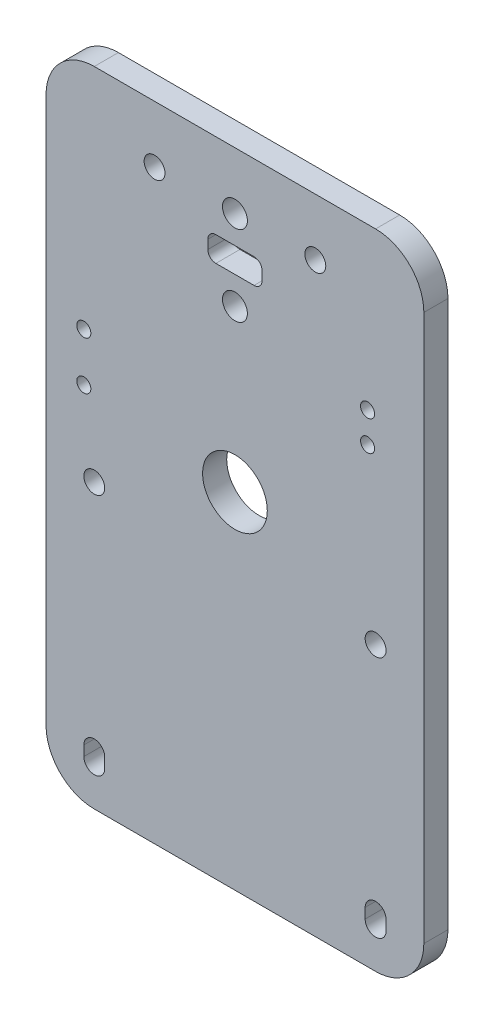
from build123d import *

# Parameters (mm, degrees)
MODEL_R           = 2.6
MODEL_R_2         = 3.1
MODEL_W           = 13.5
MODEL_H           = 6.2
BASE_DEPTH        = 6
SKETCH_1_R        = 8.05
BEARINGHOLE_DEPTH = 10
SKETCH1_R         = 1.75
SENSORMOUNT_DEPTH = 10
SKETCH3_R         = 1.75
CABLEMOUNT_DEPTH  = 10
FILLETCABLESLOT_R = 2


with BuildPart() as part:
    # Model → Base (new body)
    with BuildSketch(Plane.XY):
        with BuildLine():
            Line((35, 160), (-35, 160))
            ThreePointArc((-35, 160), (-43.485281374, 156.485281374), (-47, 148))
            Line((-47, 148), (-47, 12))
            ThreePointArc((-47, 12), (-43.485281374, 3.514718626), (-35, 0))
            Line((-35, 0), (35, 0))
            ThreePointArc((35, 0), (43.485281374, 3.514718626), (47, 12))
            Line((47, 12), (47, 148))
            ThreePointArc((47, 148), (43.485281374, 156.485281374), (35, 160))
        make_face()
        with BuildLine():
            ThreePointArc((-37.6, 12.5), (-35, 15.1), (-32.4, 12.5))
            Line((-32.4, 12.5), (-32.4, 10))
            ThreePointArc((-32.4, 10), (-35, 7.4), (-37.6, 10))
            Line((-37.6, 10), (-37.6, 12.5))
        make_face(mode=Mode.SUBTRACT)
        with Locations((-35, 70.45)):
            Circle(MODEL_R, mode=Mode.SUBTRACT)
        with BuildLine():
            Line((32.4, 10), (32.4, 12.5))
            ThreePointArc((32.4, 12.5), (35, 15.1), (37.6, 12.5))
            Line((37.6, 12.5), (37.6, 10))
            ThreePointArc((37.6, 10), (35, 7.4), (32.4, 10))
        make_face(mode=Mode.SUBTRACT)
        with Locations((35, 70.45)):
            Circle(MODEL_R, mode=Mode.SUBTRACT)
        with Locations((-20, 145.8)):
            Circle(MODEL_R, mode=Mode.SUBTRACT)
        with Locations((0, 125.8)):
            Circle(MODEL_R_2, mode=Mode.SUBTRACT)
        with Locations((0, 135.8)):
            Rectangle(MODEL_W, MODEL_H, mode=Mode.SUBTRACT)
        with Locations((0, 145.8)):
            Circle(MODEL_R_2, mode=Mode.SUBTRACT)
        with Locations((20, 145.8)):
            Circle(MODEL_R, mode=Mode.SUBTRACT)
    extrude(amount=BASE_DEPTH)

    # Эскиз1 → BearingHole (cut)
    with BuildSketch(Plane(origin=(0, 0, 0), x_dir=(-1, 0, 0), z_dir=(0, 0, -1))):
        with Locations((0, 85.8)):
            Circle(SKETCH_1_R)
    extrude(amount=-BEARINGHOLE_DEPTH, mode=Mode.SUBTRACT)

    # Sketch1 → SensorMount (cut)
    with BuildSketch(Plane.XY.offset(6)):
        with Locations((33, 120)):
            Circle(SKETCH1_R)
        with Locations((33, 112.5)):
            Circle(SKETCH1_R)
    extrude(amount=-SENSORMOUNT_DEPTH, mode=Mode.SUBTRACT)

    # Sketch3 → CableMount (cut)
    with BuildSketch(Plane(origin=(0, 0, 0), x_dir=(-1, 0, 0), z_dir=(0, 0, -1))):
        with Locations((37.6, 90.08855339)):
            Circle(SKETCH3_R)
        with Locations((37.6, 102.08855339)):
            Circle(SKETCH3_R)
    extrude(amount=-CABLEMOUNT_DEPTH, mode=Mode.SUBTRACT)

    # FilletCableSlot
    filletcableslot_edges = [part.edges().sort_by_distance(p)[0] for p in [
        (6.75, 138.9, 3),
        (-6.75, 138.9, 3),
        (-6.75, 132.7, 3),
        (6.75, 132.7, 3),
    ]]
    fillet(filletcableslot_edges, radius=FILLETCABLESLOT_R)


solid = part.part
